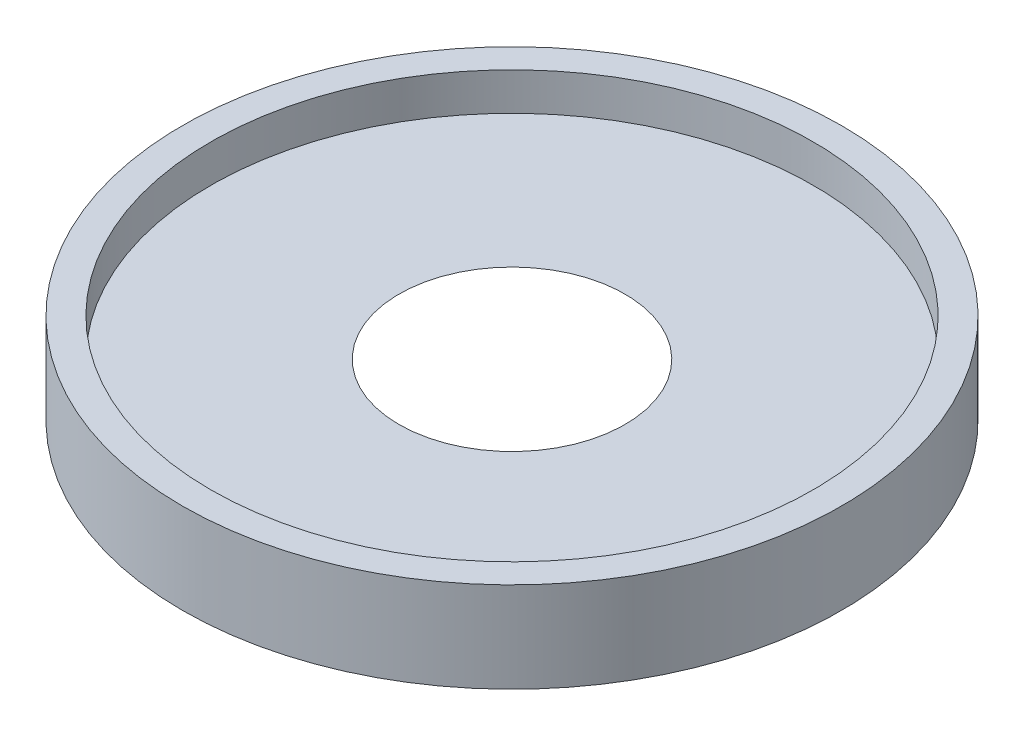
from build123d import *

# Parameters (mm, degrees)
SKETCH2_R           = 11.1125
BOSS_EXTRUDE1_DEPTH = 3.048
SKETCH3_R           = 10.16
CUT_EXTRUDE1_DEPTH  = 1.27
SKETCH4_R           = 3.81
CUT_EXTRUDE2_DEPTH  = 2.54
FILLET1_R           = 10.16


with BuildPart() as part:
    # Sketch2 → Boss-Extrude1 (new body)
    with BuildSketch(Plane(origin=(0, 0, 0), x_dir=(1, 0, 0), z_dir=(0, 1, 0))):
        with Locations(Location((0, 0, 0), (0, 0, 90))):
            Circle(SKETCH2_R)
    extrude(amount=BOSS_EXTRUDE1_DEPTH)

    # Sketch3 → Cut-Extrude1 (cut)
    with BuildSketch(Plane(origin=(0, 3.048, 0), x_dir=(1, 0, 0), z_dir=(0, 1, 0))):
        with Locations(Location((0, 0, 0), (0, 0, 270))):
            Circle(SKETCH3_R)
    extrude(amount=-CUT_EXTRUDE1_DEPTH, mode=Mode.SUBTRACT)

    # Sketch4 → Cut-Extrude2 (cut)
    with BuildSketch(Plane(origin=(0, 0, 0), x_dir=(-1, 0, 0), z_dir=(0, -1, 0))):
        with Locations(Location((0, 0, 0), (0, 0, 90))):
            Circle(SKETCH4_R)
    extrude(amount=-CUT_EXTRUDE2_DEPTH, mode=Mode.SUBTRACT)

    # Fillet1
    # the kernel refuses this fillet: 10.16 mm, written as the material it takes off along each edge
    with BuildSketch(Plane(origin=(0, 0, 0), x_dir=(0, 0, -1), z_dir=(-1, 0, 0))) as fillet1_piece_1:
        with BuildLine():
            CenterArc((9.551748514, -10.16), FILLET1_R, 90, 34.41150867)
            Line((3.81, -1.778), (3.81, 0))
            Line((3.81, 0), (9.551748514, 0))
        make_face()
    revolve(axis=Axis((0, 0, 0), (0, -1, 0)), mode=Mode.SUBTRACT)


solid = part.part
